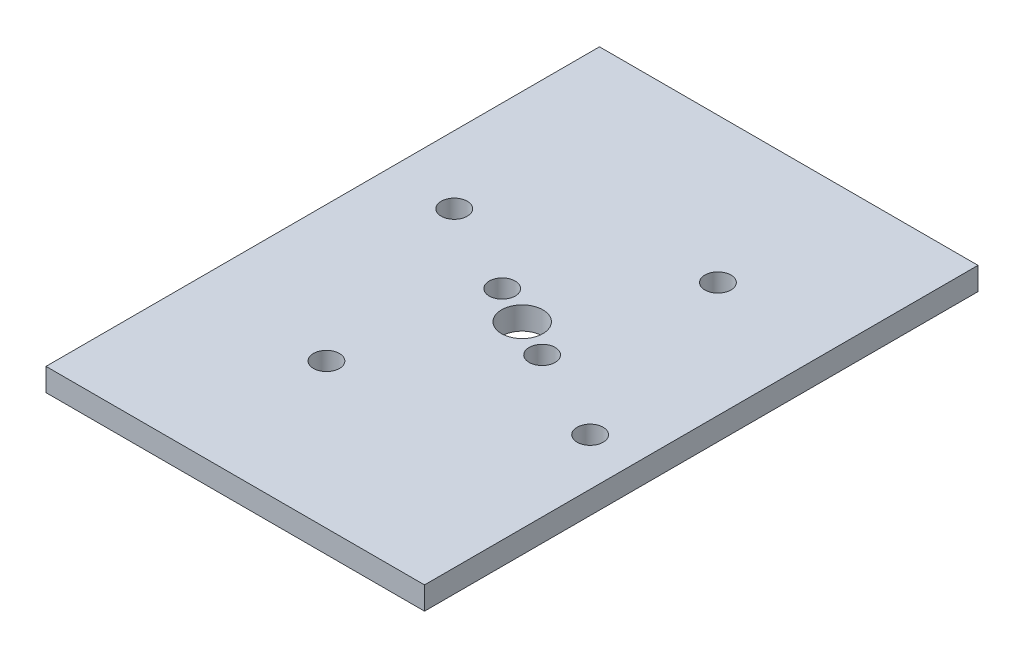
from build123d import *

# Parameters (mm, degrees)
SKETCH_1_W          = 58.128760995
SKETCH_1_H          = 85
SKETCH_1_R          = 3.175
EXTRUDE_1_DEPTH     = 3.5
SKETCH_2_R          = 2
CUT_EXTRUDE_1_DEPTH = 53.503533215


with BuildPart() as part:
    # Эскиз1 → Вытянуть1 (new body)
    with BuildSketch(Plane(origin=(0, 0, 0), x_dir=(1, 0, 0), z_dir=(0, 1, 0))):
        with Locations((-1.564380498, 0)):
            Rectangle(SKETCH_1_W, SKETCH_1_H)
        Circle(SKETCH_1_R, mode=Mode.SUBTRACT)
    extrude(amount=EXTRUDE_1_DEPTH)

    # Эскиз2 → Вырез-Вытянуть1 (cut, through all)
    with BuildSketch(Plane(origin=(0, 3.5, 0), x_dir=(1, 0, 0), z_dir=(0, 1, 0))):
        with Locations((-5.945819696, 2.881931911)):
            Circle(SKETCH_2_R)
        with Locations((5.945819696, -2.881931911)):
            Circle(SKETCH_2_R)
        with Locations((20.247006678, -9.813700656)):
            Circle(SKETCH_2_R)
        with Locations((9.813700656, 20.247006678)):
            Circle(SKETCH_2_R)
        with Locations((-9.813700656, -20.247006678)):
            Circle(SKETCH_2_R)
        with Locations((-20.247006678, 9.813700656)):
            Circle(SKETCH_2_R)
    extrude(amount=-CUT_EXTRUDE_1_DEPTH, mode=Mode.SUBTRACT)


solid = part.part
